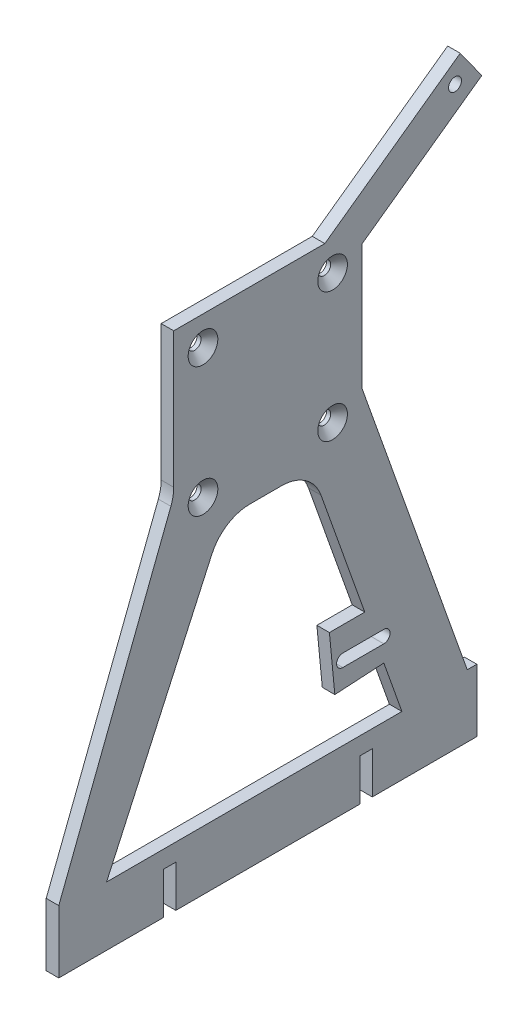
from build123d import *

# Parameters (mm, degrees)
SKETCH1_R           = 1.55
BOSS_EXTRUDE2_DEPTH = 3
CHAMFER1_SIZE       = 2
FILLET2_R           = 10


with BuildPart() as part:
    # Sketch1 → Boss-Extrude2 (new body)
    with BuildSketch(Plane(origin=(0, 0, 0), x_dir=(0, 0, -1), z_dir=(1, 0, 0))):
        Polygon((27.5, 86.038878339), (0, 15), (0, 0), (25, 0), (25, 10), (28, 10), (28, 0), (72, 0), (72, 10), (75, 10), (75, 0), (100, 0), (100, 15), (97.712949054, 15), (72.5, 85.972228566), (72.5, 115.777505785), (101.188836249, 136.361351308), (96.028796163, 143.553182634), (63.647000246, 120.31968933), (27.5, 120.31968933), align=None)
        Polygon((39.282646226, 75.31968933), (60.365916003, 75.31968933), (73.198877763, 39.196033454), (64.741637437, 39.196033454), (66.036256754, 25.688126343), (77.753857358, 26.374167507), (82.089729195, 14.16907058), (11.439152216, 14.16907058), align=None, mode=Mode.SUBTRACT)
        with BuildLine():
            ThreePointArc((67.956429084, 30.345444875), (66.456429084, 31.845444875), (67.956429084, 33.345444875))
            Line((67.956429084, 33.345444875), (77.753857358, 33.345444875))
            ThreePointArc((77.753857358, 33.345444875), (79.253857358, 31.845444875), (77.753857358, 30.345444875))
            Line((77.753857358, 30.345444875), (67.956429084, 30.345444875))
        make_face(mode=Mode.SUBTRACT)
        with Locations((65.5, 82.31968933)):
            Circle(SKETCH1_R, mode=Mode.SUBTRACT)
        with Locations((65.5, 113.31968933)):
            Circle(SKETCH1_R, mode=Mode.SUBTRACT)
        with Locations((34.5, 82.31968933)):
            Circle(SKETCH1_R, mode=Mode.SUBTRACT)
        with Locations((34.5, 113.31968933)):
            Circle(SKETCH1_R, mode=Mode.SUBTRACT)
        with Locations((94.78540169, 137.754328185)):
            Circle(SKETCH1_R, mode=Mode.SUBTRACT)
    extrude(amount=BOSS_EXTRUDE2_DEPTH)

    # Chamfer1
    chamfer1_edges = [part.edges().sort_by_distance(p)[0] for p in [
        (3, 82.31968933, -32.95),
        (3, 82.31968933, -63.95),
        (3, 113.31968933, -63.95),
        (3, 113.31968933, -32.95),
    ]]
    chamfer(chamfer1_edges, length=CHAMFER1_SIZE)

    # Fillet2
    fillet2_edges = [part.edges().sort_by_distance(p)[0] for p in [
        (1.5, 75.31968933, -60.365916003),
        (1.5, 75.31968933, -39.282646226),
        (1.5, 86.038878339, -27.5),
    ]]
    fillet(fillet2_edges, radius=FILLET2_R)


solid = part.part
